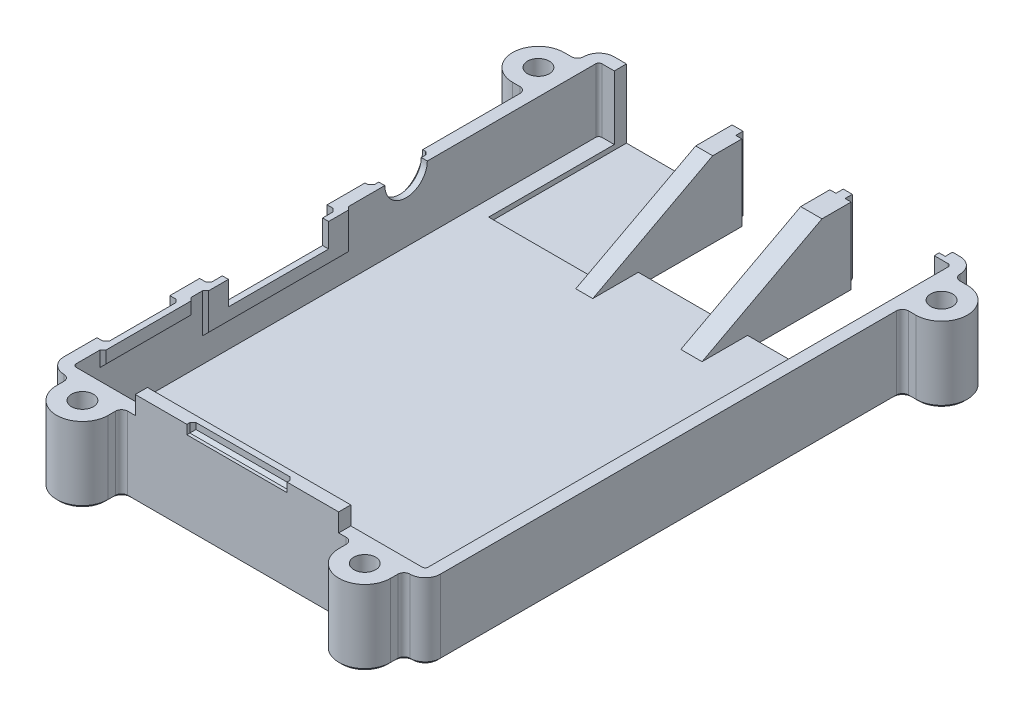
from build123d import *

# Parameters (mm, degrees)
BASE_DEPTH                      = 12.5
SHELL_T                         = -2
CLAMPS_DEPTH                    = 12.5
CLAMP_FILLETS_R                 = 1
SKETCH20_R                      = 1.8
CLAMP_HOLES_DEPTH               = 115.236651299
SKETCH21_R                      = 2.9
CLAMP_COUNTERSINKS_DEPTH        = 3.4
CLAMP_COUNTERSINK_CHAMFERS_SIZE = 0.3
SKETCH22_W                      = 33.5
SKETCH22_H                      = 2
SD_FILL_DEPTH                   = 3
SKETCH23_W                      = 16.5
SKETCH23_H                      = 1.5
SD_APPROACH_DEPTH               = 1
SD_APPROACH_CHAMFER_SIZE        = 0.5
SKETCH24_W                      = 14.5
SKETCH24_H                      = 12.5
USB_CUTOUT_DEPTH                = 18.25
SKETCH25_W                      = 16.5
SKETCH25_H                      = 12.5
USB_APPROACH_DEPTH              = 1.2
USB_INNER_SUPPORT_DEPTH         = 3.5
USB_OUTER_SUPPORT_DEPTH         = 2.8
SKETCH28_W                      = 17.4
SKETCH28_H                      = 11.3
RJ45_CUTOUT_DEPTH               = 22.7
SKETCH29_W                      = 15
SKETCH29_H                      = 2.5
SKETCH29_W_2                    = 24
SKETCH29_H_2                    = 6.43
HDMI_SUPPORT_DEPTH              = 0.5
HDMI_SUPPORT_CHAMFER_SIZE       = 0.5
SKETCH30_W                      = 21
SKETCH30_H                      = 5.93
SKETCH30_W_2                    = 12
SKETCH30_H_2                    = 2
HDMI_APPROACH_DEPTH             = 1.5
SKETCH31_W                      = 16.5
SKETCH31_H                      = 3.93
HDMI_CUTOUT_DEPTH               = 1
HDMI_APPROACH_CHAMFER_SIZE      = 0.5
SKETCH32_R                      = 3.5
AUDIO_CUTOUT_DEPTH              = 2
SKETCH33_R                      = 4.75
AUDIO_APPROACH_DEPTH            = 1
AUDIO_APPROACH_CHAMFER_SIZE     = 0.5
SKETCH34_W                      = 6
SKETCH34_H                      = 52.7
HEADER_CUTOUT_DEPTH             = 2
HEADER_COVER_DEPTH              = 1
SHELL_CHAMFER_SIZE              = 0.5


with BuildPart() as part:
    # Sketch2 → Base (new body)
    with BuildSketch(Plane(origin=(0, 0, 0), x_dir=(1, 0, 0), z_dir=(0, 1, 0))):
        with BuildLine():
            Line((2.5, 0), (59.5, 0))
            ThreePointArc((59.5, 0), (61.267766953, 0.732233047), (62, 2.5))
            Line((62, 2.5), (62, 88.1))
            ThreePointArc((62, 88.1), (61.267766953, 89.867766953), (59.5, 90.6))
            Line((59.5, 90.6), (2.5, 90.6))
            ThreePointArc((2.5, 90.6), (0.732233047, 89.867766953), (0, 88.1))
            Line((0, 88.1), (0, 2.5))
            ThreePointArc((0, 2.5), (0.732233047, 0.732233047), (2.5, 0))
        make_face()
    extrude(amount=BASE_DEPTH)

    # Shell
    shell_openings = [part.faces().sort_by_distance(p)[0] for p in [
        (31, 12.5, -45.3),
    ]]
    offset(amount=SHELL_T, openings=shell_openings, kind=Kind.INTERSECTION)

    # Sketch14 → Clamps (add)
    with BuildSketch(Plane.XZ):
        with BuildLine():
            Line((-2.2, -78.6), (0, -78.6))
            Line((0, -78.6), (0, -87.1))
            Line((0, -87.1), (-2.2, -87.1))
            ThreePointArc((-2.2, -87.1), (-6.45, -82.85), (-2.2, -78.6))
        make_face()
        with BuildLine():
            Line((3.5, 2.2), (3.5, 0))
            Line((3.5, 0), (12, 0))
            Line((12, 0), (12, 2.2))
            ThreePointArc((12, 2.2), (7.75, 6.45), (3.5, 2.2))
        make_face()
        with BuildLine():
            Line((64.2, -78.6), (62, -78.6))
            Line((62, -78.6), (62, -87.1))
            Line((62, -87.1), (64.2, -87.1))
            ThreePointArc((64.2, -87.1), (68.45, -82.85), (64.2, -78.6))
        make_face()
        with BuildLine():
            Line((50, 0), (50, 2.2))
            ThreePointArc((50, 2.2), (54.25, 6.45), (58.5, 2.2))
            Line((58.5, 2.2), (58.5, 0))
            Line((58.5, 0), (50, 0))
        make_face()
    extrude(amount=-CLAMPS_DEPTH)

    # Clamp Fillets
    clamp_fillets_edges = [part.edges().sort_by_distance(p)[0] for p in [
        (0, 6.25, -87.1),
        (0, 6.25, -78.6),
        (3.5, 6.25, 0),
        (12, 6.25, 0),
        (62, 6.25, -78.6),
        (62, 6.25, -87.1),
        (50, 6.25, 0),
        (58.5, 6.25, 0),
    ]]
    fillet(clamp_fillets_edges, radius=CLAMP_FILLETS_R - 0.0001)  # a hair under: the kernel refuses the full size

    # Sketch20 → Clamp Holes (cut, through all)
    with BuildSketch(Plane.XZ):
        with Locations(Location((7.75, 2.2, 0), (0, 0, 270))):
            Circle(SKETCH20_R)
        with Locations(Location((54.25, 2.2, 0), (0, 0, 270))):
            Circle(SKETCH20_R)
        with Locations(Location((64.2, -82.85, 0), (0, 0, 270))):
            Circle(SKETCH20_R)
        with Locations(Location((-2.2, -82.85, 0), (0, 0, 270))):
            Circle(SKETCH20_R)
    extrude(amount=-CLAMP_HOLES_DEPTH, mode=Mode.SUBTRACT)

    # Sketch21 → Clamp Countersinks (cut)
    with BuildSketch(Plane.XZ):
        with Locations(Location((7.75, 2.2, 0), (0, 0, 270))):
            Circle(SKETCH21_R)
        with Locations(Location((54.25, 2.2, 0), (0, 0, 270))):
            Circle(SKETCH21_R)
        with Locations(Location((64.2, -82.85, 0), (0, 0, 270))):
            Circle(SKETCH21_R)
        with Locations(Location((-2.2, -82.85, 0), (0, 0, 270))):
            Circle(SKETCH21_R)
    extrude(amount=-CLAMP_COUNTERSINKS_DEPTH, mode=Mode.SUBTRACT)

    # Clamp Countersink Chamfers
    clamp_countersink_chamfers_edges = [part.edges().sort_by_distance(p)[0] for p in [
        (-2.2, 0, -79.95),
        (64.2, 0, -79.95),
        (54.25, 0, 5.1),
        (7.75, 0, 5.1),
    ]]
    chamfer(clamp_countersink_chamfers_edges, length=CLAMP_COUNTERSINK_CHAMFERS_SIZE)

    # Sketch22 → SD Fill (add)
    with BuildSketch(Plane(origin=(0, 12.5, 0), x_dir=(1, 0, 0), z_dir=(0, 1, 0))):
        with Locations((31, 1)):
            Rectangle(SKETCH22_W, SKETCH22_H)
    extrude(amount=SD_FILL_DEPTH)

    # Sketch23 → SD Approach (cut)
    with BuildSketch(Plane.XY):
        with Locations((31, 14.75)):
            Rectangle(SKETCH23_W, SKETCH23_H)
    extrude(amount=-SD_APPROACH_DEPTH, mode=Mode.SUBTRACT)

    # SD Approach Chamfer
    sd_approach_chamfer_edges = [part.edges().sort_by_distance(p)[0] for p in [
        (22.75, 14.75, -1),
        (39.25, 14.75, -1),
        (31, 14, -1),
    ]]
    chamfer(sd_approach_chamfer_edges, length=SD_APPROACH_CHAMFER_SIZE)

    # Sketch24 → USB Cutout (cut)
    with BuildSketch(Plane(origin=(0, 0, -90.6), x_dir=(-1, 0, 0), z_dir=(0, 0, -1))):
        with Locations((-50, 6.25)):
            Rectangle(SKETCH24_W, SKETCH24_H)
        with Locations((-32, 6.25)):
            Rectangle(SKETCH24_W, SKETCH24_H)
    extrude(amount=-USB_CUTOUT_DEPTH, mode=Mode.SUBTRACT)

    # Sketch25 → USB Approach (cut)
    with BuildSketch(Plane(origin=(0, 0, -90.6), x_dir=(-1, 0, 0), z_dir=(0, 0, -1))):
        with Locations((-50, 6.25)):
            Rectangle(SKETCH25_W, SKETCH25_H)
        with Locations((-32, 6.25)):
            Rectangle(SKETCH25_W, SKETCH25_H)
    extrude(amount=-USB_APPROACH_DEPTH, mode=Mode.SUBTRACT)

    # Sketch26 → USB Inner Support (add)
    with BuildSketch(Plane(origin=(42.75, 0, 0), x_dir=(0, 0, -1), z_dir=(1, 0, 0))):
        Polygon((88.6, 2), (88.6, 12.5), (84.6, 12.5), (64.852372114, 2), align=None)
    extrude(amount=-USB_INNER_SUPPORT_DEPTH)

    # Sketch27 → USB Outer Support (add)
    with BuildSketch(Plane(origin=(24.75, 0, 0), x_dir=(0, 0, -1), z_dir=(1, 0, 0))):
        Polygon((88.6, 2), (88.6, 12.5), (84.6, 12.5), (64.852372114, 2), align=None)
    extrude(amount=-USB_OUTER_SUPPORT_DEPTH)

    # Sketch28 → RJ45 Cutout (cut)
    with BuildSketch(Plane(origin=(0, 0, -90.6), x_dir=(-1, 0, 0), z_dir=(0, 0, -1))):
        with Locations((-13.25, 6.85)):
            Rectangle(SKETCH28_W, SKETCH28_H)
    extrude(amount=-RJ45_CUTOUT_DEPTH, mode=Mode.SUBTRACT)

    # Sketch29 → HDMI Support (add)
    with BuildSketch(Plane(origin=(2, 0, 0), x_dir=(0, 0, -1), z_dir=(1, 0, 0))):
        with Locations((13.95, 11.25)):
            Rectangle(SKETCH29_W, SKETCH29_H)
        with Locations((35.35, 9.285)):
            Rectangle(SKETCH29_W_2, SKETCH29_H_2)
    extrude(amount=HDMI_SUPPORT_DEPTH)

    # HDMI Support Chamfer
    hdmi_support_chamfer_edges = [part.edges().sort_by_distance(p)[0] for p in [
        (2.5, 9.285, -47.35),
        (2.5, 6.07, -35.35),
        (2.5, 9.285, -23.35),
        (2.5, 11.25, -21.45),
        (2.5, 10, -13.95),
        (2.5, 11.25, -6.45),
    ]]
    chamfer(hdmi_support_chamfer_edges, length=HDMI_SUPPORT_CHAMFER_SIZE - 0.0001)  # a hair under: the kernel refuses the full size

    # Sketch30 → HDMI Approach (cut)
    with BuildSketch(Plane.ZY):
        with Locations((-35.35, 9.535)):
            Rectangle(SKETCH30_W, SKETCH30_H)
        with Locations((-13.95, 11.5)):
            Rectangle(SKETCH30_W_2, SKETCH30_H_2)
    extrude(amount=-HDMI_APPROACH_DEPTH, mode=Mode.SUBTRACT)

    # Sketch31 → HDMI Cutout (cut)
    with BuildSketch(Plane.ZY.offset(-1.5)):
        with Locations((-35.35, 10.535)):
            Rectangle(SKETCH31_W, SKETCH31_H)
    extrude(amount=-HDMI_CUTOUT_DEPTH, mode=Mode.SUBTRACT)

    # HDMI Approach Chamfer
    hdmi_approach_chamfer_edges = [part.edges().sort_by_distance(p)[0] for p in [
        (1.5, 9.535, -24.85),
        (1.5, 6.57, -35.35),
        (1.5, 9.535, -45.85),
        (1.5, 11.5, -19.95),
        (1.5, 11.5, -7.95),
        (1.5, 10.5, -13.95),
    ]]
    chamfer(hdmi_approach_chamfer_edges, length=HDMI_APPROACH_CHAMFER_SIZE)

    # Sketch32 → Audio Cutout (cut)
    with BuildSketch(Plane.ZY):
        with Locations((-56.85, 12.5)):
            Circle(SKETCH32_R)
    extrude(amount=-AUDIO_CUTOUT_DEPTH, mode=Mode.SUBTRACT)

    # Sketch33 → Audio Approach (cut)
    with BuildSketch(Plane.ZY):
        with Locations((-56.85, 12.5)):
            Circle(SKETCH33_R)
    extrude(amount=-AUDIO_APPROACH_DEPTH, mode=Mode.SUBTRACT)

    # Audio Approach Chamfer
    audio_approach_chamfer_edges = [part.edges().sort_by_distance(p)[0] for p in [
        (1, 7.75, -56.85),
    ]]
    chamfer(audio_approach_chamfer_edges, length=AUDIO_APPROACH_CHAMFER_SIZE)

    # Sketch34 → Header Cutout (cut)
    with BuildSketch(Plane.XZ):
        with Locations((55.5, -35.75)):
            Rectangle(SKETCH34_W, SKETCH34_H)
    extrude(amount=-HEADER_CUTOUT_DEPTH, mode=Mode.SUBTRACT)

    # Sketch35 → Header Cover (add)
    with BuildSketch(Plane.XZ):
        Polygon((56, -9.4), (55, -9.4), (55, -10.4), (53.5, -10.4), (53.5, -15.3625), (52.5, -15.3625), (52.5, -16.3625), (53.5, -16.3625), (53.5, -28.2875), (52.5, -28.2875), (52.5, -29.2875), (53.5, -29.2875), (53.5, -34.25), (55, -34.25), (55, -35.25), (52.5, -35.25), (52.5, -36.25), (55, -36.25), (55, -37.25), (53.5, -37.25), (53.5, -42.2125), (52.5, -42.2125), (52.5, -43.2125), (53.5, -43.2125), (53.5, -55.1375), (52.5, -55.1375), (52.5, -56.1375), (53.5, -56.1375), (53.5, -61.1), (55, -61.1), (55, -62.1), (56, -62.1), (56, -61.1), (57.5, -61.1), (57.5, -56.1375), (58.5, -56.1375), (58.5, -55.1375), (57.5, -55.1375), (57.5, -43.2125), (58.5, -43.2125), (58.5, -42.2125), (57.5, -42.2125), (57.5, -37.25), (56, -37.25), (56, -36.25), (58.5, -36.25), (58.5, -35.25), (56, -35.25), (56, -34.25), (57.5, -34.25), (57.5, -29.2875), (58.5, -29.2875), (58.5, -28.2875), (57.5, -28.2875), (57.5, -16.3625), (58.5, -16.3625), (58.5, -15.3625), (57.5, -15.3625), (57.5, -10.4), (56, -10.4), align=None)
    extrude(amount=-HEADER_COVER_DEPTH)

    # Shell Chamfer
    shell_chamfer_edges = [part.edges().sort_by_distance(p)[0] for p in [
        (-1.59995, 0, -78.6),
        (63.59995, 0, -87.1),
        (49.707136071, 0, 0.292863929),
        (0.732233047, 0, -0.732233047),
        (58.792863929, 0, 0.292863929),
        (12.292863929, 0, 0.292863929),
        (3.207136071, 0, 0.292863929),
        (-0.292863929, 0, -87.392863929),
        (-0.292863929, 0, -78.307136071),
        (62.292863929, 0, -78.307136071),
        (62.292863929, 0, -87.392863929),
        (13.125, 0, -90.6),
        (41, 0, -90.6),
        (-6.45, 0, -82.85),
        (-1.59995, 0, -87.1),
        (7.75, 0, 6.45),
        (3.5, 0, 1.59995),
        (52.5, 0, -12.38125),
        (53.75, 0, -62.1),
        (58.5, 0, -59.11875),
        (57.25, 0, -9.4),
        (57.25, 0, -62.1),
        (58.5, 0, -49.175),
        (58.5, 0, -39.23125),
        (58.5, 0, -32.26875),
        (58.5, 0, -22.325),
        (58.5, 0, -12.38125),
        (53.75, 0, -9.4),
        (52.5, 0, -22.325),
        (52.5, 0, -32.26875),
        (52.5, 0, -39.23125),
        (52.5, 0, -49.175),
        (52.5, 0, -59.11875),
        (68.45, 0, -82.85),
        (63.59995, 0, -78.6),
        (54.25, 0, 6.45),
        (50, 0, 1.59995),
        (0.732233047, 0, -89.867766953),
        (58.875, 0, -90.6),
        (61.267766953, 0, -89.867766953),
        (31, 0, 0),
        (62, 0, -40.05005),
        (58.5, 0, 1.59995),
        (12, 0, 1.59995),
        (61.267766953, 0, -0.732233047),
        (0, 0, -40.05005),
    ]]
    chamfer(shell_chamfer_edges, length=SHELL_CHAMFER_SIZE)


solid = part.part
